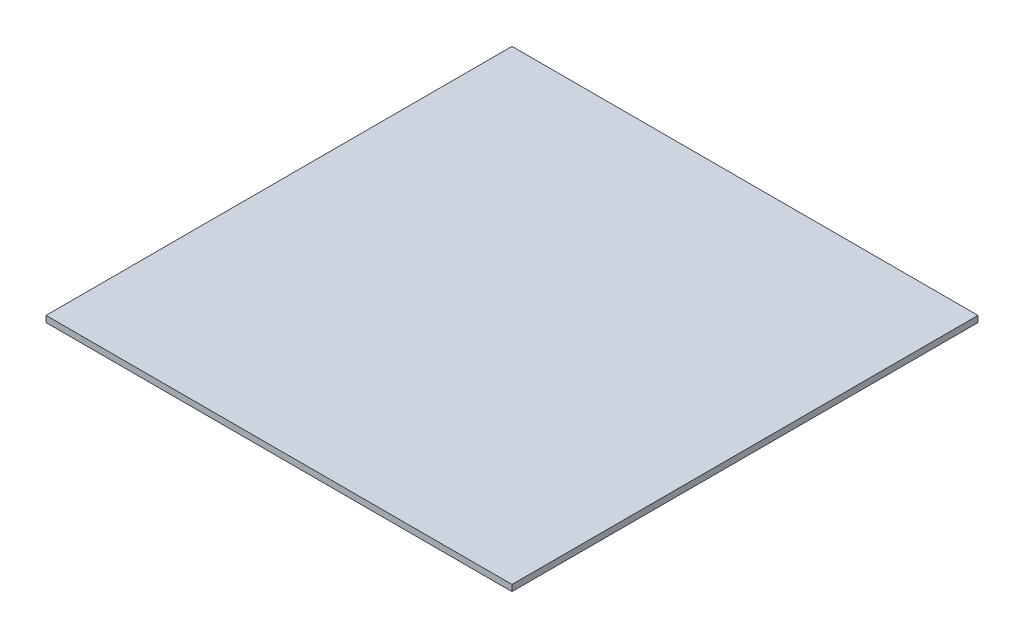
from build123d import *

# Parameters (mm, degrees)
SKETCH1_W           = 112.07
SKETCH1_H           = 112.07
BOSS_EXTRUDE1_DEPTH = 1.5


with BuildPart() as part:
    # Sketch1 → Boss-Extrude1 (new body)
    with BuildSketch(Plane(origin=(0, 0, 0), x_dir=(1, 0, 0), z_dir=(0, 1, 0))):
        Rectangle(SKETCH1_W, SKETCH1_H)
    extrude(amount=BOSS_EXTRUDE1_DEPTH)


solid = part.part
